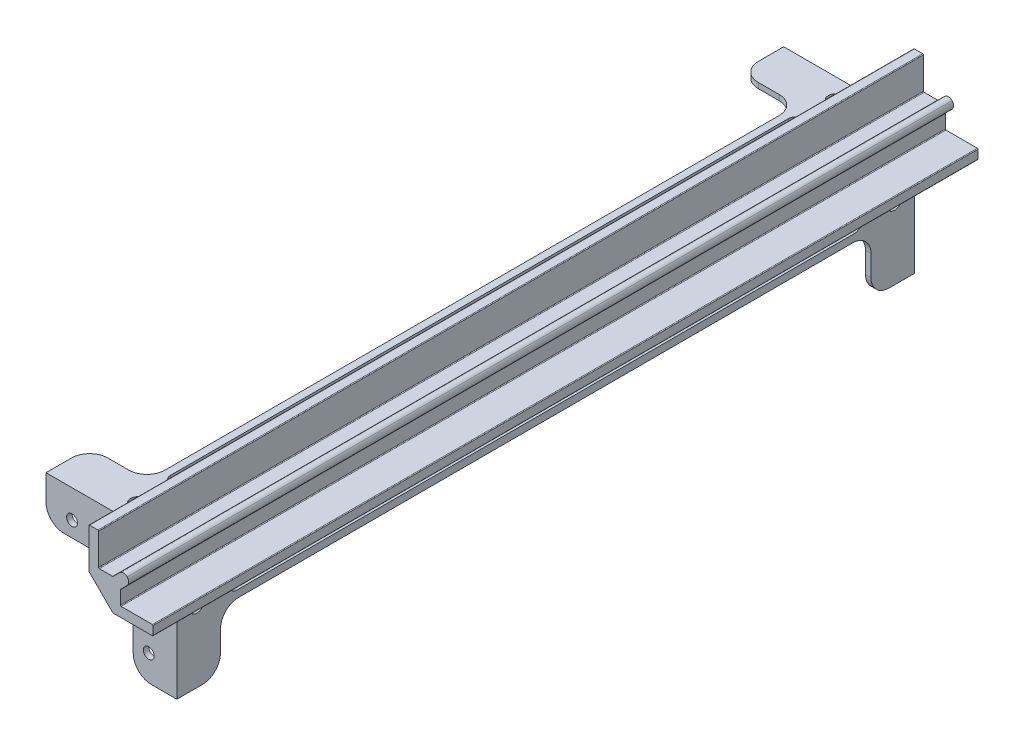
from build123d import *

# Parameters (mm, degrees)
BOSS_EXTRUDE1_DEPTH   = 227
CUT_EXTRUDE1_DEPTH    = 257.229581821
SKETCH3_W             = 10
SKETCH3_H             = 15.5
CUT_EXTRUDE2_DEPTH    = 234.473879022
SKETCH4_W             = 15.5
SKETCH4_H             = 10
CUT_EXTRUDE3_DEPTH    = 252.639093083
FILLET3_R             = 1.5
BOSS_EXTRUDE3_DEPTH   = 1.5
BOSS_EXTRUDE4_DEPTH   = 1.5
SKETCH9_W             = 26
SKETCH9_H             = 12
BOSS_EXTRUDE5_DEPTH   = 1.5
SKETCH10_W            = 12
SKETCH10_H            = 26
BOSS_EXTRUDE6_DEPTH   = 1.5
FILLET7_R             = 5
SKETCH11_R            = 2
CUT_EXTRUDE4_DEPTH    = 10
SKETCH12_R            = 2
CUT_EXTRUDE5_DEPTH    = 10
FILLET8_R             = 0.2
F_3_0MM_DOWEL_HOLE1_D = 3
F_3_0MM_DOWEL_HOLE2_D = 3


with BuildPart() as part:
    # Sketch1 → Boss-Extrude1 (new body)
    with BuildSketch(Plane.XY):
        Polygon((5.710530524, 107.230570717), (35.710530524, 107.230570717), (35.710530524, 97.694605712), (39.660530524, 97.694605712), (42.571762587, 100.605837775), (44.621762586, 98.555837776), (41.710530523, 95.644605712), (41.710530523, 91.694605712), (51.246495528, 91.694605712), (51.246495528, 61.694605712), align=None)
    extrude(amount=BOSS_EXTRUDE1_DEPTH)

    # Sketch2 → Cut-Extrude1 (cut, through all)
    with BuildSketch(Plane(origin=(0, 0, 0), x_dir=(-1, 0, 0), z_dir=(0, 0, -1))):
        Polygon((-45.246495528, 88.994605712), (-45.246495528, 80.994605712), (-43.746495528, 80.994605712), (-43.746495528, 88.994605712), (-39.660530524, 88.994605712), (-33.010530524, 95.644605712), (-33.010530524, 99.730570717), (-25.010530524, 99.730570717), (-25.010530524, 101.230570717), (-33.010530524, 101.230570717), (-33.010530524, 106.694605712), (-36.710530524, 106.694605712), (-36.710530524, 108.694605712), (27.289469476, 108.694605712), (-52.710530523, 28.694605712), (-52.710530523, 92.694605712), (-50.710530523, 92.694605712), (-50.710530523, 88.994605712), align=None)
    extrude(amount=-CUT_EXTRUDE1_DEPTH, mode=Mode.SUBTRACT)

    # Sketch3 → Cut-Extrude2 (cut, through all)
    with BuildSketch(Plane(origin=(0, 101.230570717, 0), x_dir=(1, 0, 0), z_dir=(0, 1, 0))):
        with Locations((28.010530524, -5.75)):
            Rectangle(SKETCH3_W, SKETCH3_H)
        with Locations((28.010530524, -221.25)):
            Rectangle(SKETCH3_W, SKETCH3_H)
        with BuildLine():
            Line((31.010530524, -28.5), (31.010530524, -198.5))
            ThreePointArc((31.010530524, -198.5), (29.010530524, -200.5), (27.010530524, -198.5))
            Line((27.010530524, -198.5), (27.010530524, -28.5))
            ThreePointArc((27.010530524, -28.5), (29.010530524, -26.5), (31.010530524, -28.5))
        make_face()
    extrude(amount=-CUT_EXTRUDE2_DEPTH, mode=Mode.SUBTRACT)

    # Sketch4 → Cut-Extrude3 (cut, through all)
    with BuildSketch(Plane(origin=(45.246495528, 0, 0), x_dir=(0, 0, -1), z_dir=(1, 0, 0))):
        with Locations((-221.25, 83.994605712)):
            Rectangle(SKETCH4_W, SKETCH4_H)
        with Locations((-5.75, 83.994605712)):
            Rectangle(SKETCH4_W, SKETCH4_H)
        with BuildLine():
            Line((-198.5, 86.994605712), (-28.5, 86.994605712))
            ThreePointArc((-28.5, 86.994605712), (-26.5, 84.994605712), (-28.5, 82.994605712))
            Line((-28.5, 82.994605712), (-198.5, 82.994605712))
            ThreePointArc((-198.5, 82.994605712), (-200.5, 84.994605712), (-198.5, 86.994605712))
        make_face()
    extrude(amount=-CUT_EXTRUDE3_DEPTH, mode=Mode.SUBTRACT)

    # Fillet3
    # the kernel refuses this fillet: 1.5 mm, written as the material it takes off along each edge
    with BuildSketch(Plane(origin=(44.621762586, 98.555837776, -3.75), x_dir=(-0.7071067811865522, -0.7071067811865428, 0), z_dir=(0, 0, 1)), Plane(origin=(42.571762587, 100.605837775, -3.75), x_dir=(0.7071067811865476, -0.7071067811865476, 0), z_dir=(0, 0, 1))) as fillet3_piece_1:
        with BuildLine():
            CenterArc((FILLET3_R, -FILLET3_R), FILLET3_R, 90, 90)
            Line((0, -FILLET3_R), (0, 0))
            Line((0, 0), (FILLET3_R, 0))
        make_face()
    extrude(amount=234.5, mode=Mode.SUBTRACT)

    # Sketch6 → Boss-Extrude3 (add)
    with BuildSketch(Plane(origin=(0, 0, 13.5), x_dir=(-1, 0, 0), z_dir=(0, 0, -1))):
        Polygon((-45.246495528, 90.194605712), (-45.246495528, 65.230570717), (-33.246495528, 65.230570717), (-33.246495528, 89.230570717), (-9.246495528, 89.230570717), (-9.246495528, 101.230570717), (-34.210530524, 101.230570717), (-34.210530524, 96.230570717), (-40.246495528, 90.194605712), align=None)
    extrude(amount=BOSS_EXTRUDE3_DEPTH)

    # Sketch7 → Boss-Extrude4 (add)
    with BuildSketch(Plane.XY.offset(213.5)):
        Polygon((9.246495528, 101.230570717), (34.210530524, 101.230570717), (34.210530524, 96.230570717), (40.246495528, 90.194605712), (45.246495528, 90.194605712), (45.246495528, 65.230570717), (33.246495528, 65.230570717), (33.246495528, 89.230570717), (9.246495528, 89.230570717), align=None)
    extrude(amount=BOSS_EXTRUDE4_DEPTH)

    # Sketch9 → Boss-Extrude5 (add)
    with BuildSketch(Plane(origin=(0, 101.230570717, 0), x_dir=(1, 0, 0), z_dir=(0, 1, 0))):
        with Locations((22.246495528, -209)):
            Rectangle(SKETCH9_W, SKETCH9_H)
        with Locations((22.246495528, -18)):
            Rectangle(SKETCH9_W, SKETCH9_H)
    extrude(amount=-BOSS_EXTRUDE5_DEPTH)

    # Sketch10 → Boss-Extrude6 (add)
    with BuildSketch(Plane(origin=(45.246495528, 0, 0), x_dir=(0, 0, -1), z_dir=(1, 0, 0))):
        with Locations((-209, 78.230570717)):
            Rectangle(SKETCH10_W, SKETCH10_H)
        with Locations((-18, 78.230570717)):
            Rectangle(SKETCH10_W, SKETCH10_H)
    extrude(amount=-BOSS_EXTRUDE6_DEPTH)

    # Fillet7
    fillet7_edges = [part.edges().sort_by_distance(p)[0] for p in [
        (33.246495528, 65.230570717, 12.75),
        (33.246495528, 89.230570717, 12.75),
        (9.246495528, 89.230570717, 12.75),
        (9.246495528, 89.230570717, 214.25),
        (33.246495528, 89.230570717, 214.25),
        (33.246495528, 65.230570717, 214.25),
        (9.246495528, 100.480570717, 203),
        (25.010530524, 100.480570717, 203),
        (9.246495528, 100.480570717, 24),
        (25.010530524, 100.480570717, 24),
        (44.496495528, 65.230570717, 203),
        (44.496495528, 80.994605712, 203),
        (44.496495528, 65.230570717, 24),
        (44.496495528, 80.994605712, 24),
    ]]
    fillet(fillet7_edges, radius=FILLET7_R)

    # Sketch11 → Cut-Extrude4 (cut)
    with BuildSketch(Plane(origin=(45.246495528, 0, 0), x_dir=(0, 0, -1), z_dir=(1, 0, 0))):
        with Locations(Location((-209.5, 84.994605712, 0), (0, 0, 90))):
            Circle(SKETCH11_R)
        with Locations(Location((-17.5, 84.994605712, 0), (0, 0, 90))):
            Circle(SKETCH11_R)
    extrude(amount=-CUT_EXTRUDE4_DEPTH, mode=Mode.SUBTRACT)

    # Sketch12 → Cut-Extrude5 (cut)
    with BuildSketch(Plane(origin=(0, 101.230570717, 0), x_dir=(1, 0, 0), z_dir=(0, 1, 0))):
        with Locations(Location((29.010530524, -17.5, 0), (0, 0, 270))):
            Circle(SKETCH12_R)
        with Locations(Location((29.010530524, -209.5, 0), (0, 0, 270))):
            Circle(SKETCH12_R)
    extrude(amount=-CUT_EXTRUDE5_DEPTH, mode=Mode.SUBTRACT)

    # Fillet8
    fillet8_edges = [part.edges().sort_by_distance(p)[0] for p in [
        (35.710530524, 97.694605712, 113.5),
        (39.660530524, 97.694605712, 113.5),
        (41.710530523, 95.644605712, 113.5),
        (41.710530523, 91.694605712, 113.5),
        (50.710530523, 91.694605712, 113.5),
        (35.710530524, 106.694605712, 113.5),
        (33.010530524, 106.694605712, 113.5),
        (50.710530523, 88.994605712, 113.5),
    ]]
    fillet(fillet8_edges, radius=FILLET8_R)

    # Ø3.0mm Dowel Hole1 (through all)
    with Locations(Plane.XY.offset(215)):
        with Locations((16.410530524, 93.494605712)):
            Hole(F_3_0MM_DOWEL_HOLE1_D / 2)

    # Ø3.0mm Dowel Hole2 (through all)
    with Locations(Plane.XY.offset(215)):
        with Locations((37.510530524, 72.394605712)):
            Hole(F_3_0MM_DOWEL_HOLE2_D / 2)


solid = part.part
